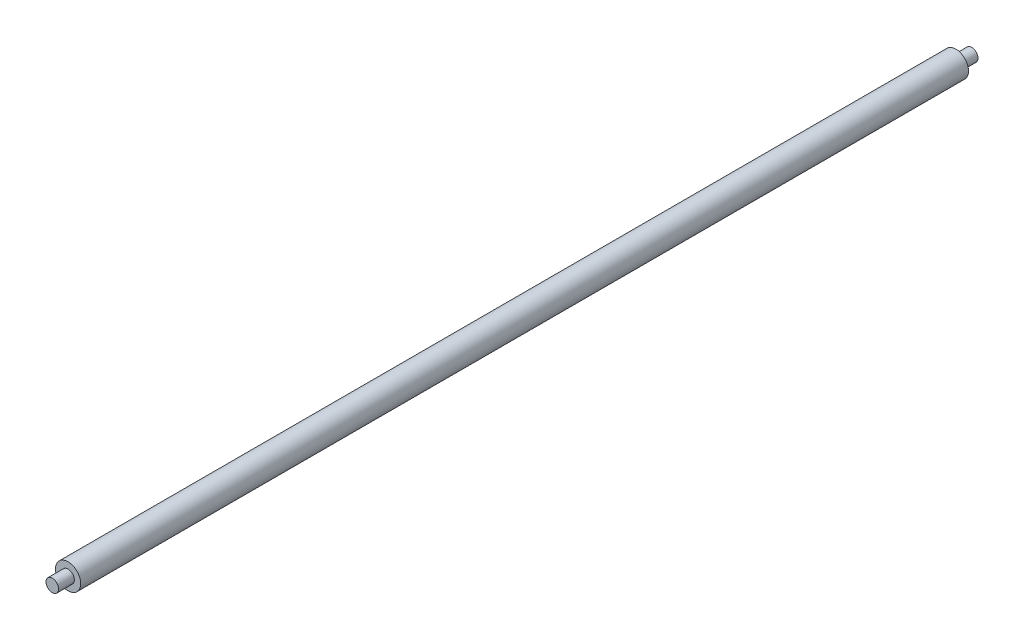
from build123d import *

# Parameters (mm, degrees)
SKETCH1_R           = 6
BOSS_EXTRUDE1_DEPTH = 211.25
SKETCH2_R           = 3
BOSS_EXTRUDE4_DEPTH = 7.5
BOSS_EXTRUDE5_START = 7.5
SKETCH3_R           = 3
BOSS_EXTRUDE5_DEPTH = 7.5


with BuildPart() as part:
    # Sketch1 → Boss-Extrude1 (new, symmetric)
    with BuildSketch(Plane.XY):
        Circle(SKETCH1_R)
    extrude(amount=BOSS_EXTRUDE1_DEPTH, both=True)

    # Sketch2 → Boss-Extrude4 (add)
    with BuildSketch(Plane.XY.offset(211.25)):
        Circle(SKETCH2_R)
    extrude(amount=BOSS_EXTRUDE4_DEPTH)

    # Sketch3 → Boss-Extrude5 (add)
    with BuildSketch(Plane(origin=(0, 0, -211.25), x_dir=(-1, 0, 0), z_dir=(0, 0, -1)).offset(BOSS_EXTRUDE5_START)):
        Circle(SKETCH3_R)
    extrude(amount=-BOSS_EXTRUDE5_DEPTH)


solid = part.part
